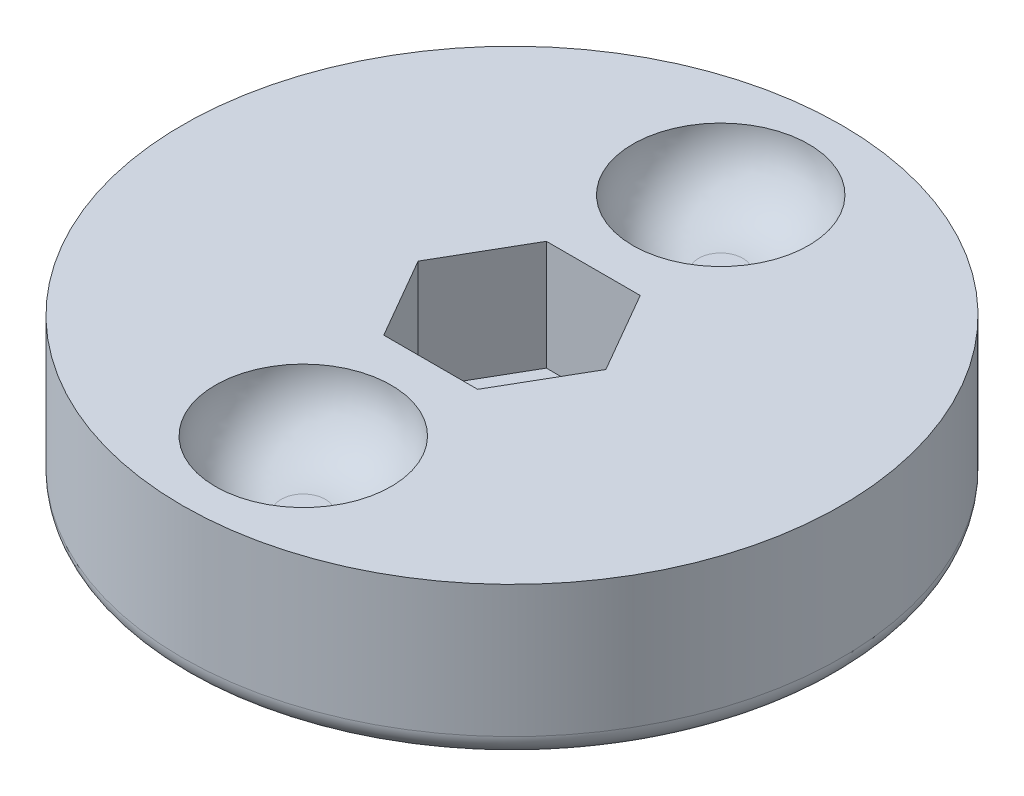
from build123d import *

# Parameters (mm, degrees)
SKETCH1_R           = 19.05
SKETCH1_R_2         = 2.794
BOSS_EXTRUDE1_DEPTH = 2.54
SKETCH2_R           = 19.05
BOSS_EXTRUDE2_DEPTH = 6.35
SKETCH3_R           = 5.08
CUT_EXTRUDE1_DEPTH  = 3.81
FILLET1_R           = 3.81
FILLET2_R           = 1.27


with BuildPart() as part:
    # Sketch1 → Boss-Extrude1 (new body)
    with BuildSketch(Plane(origin=(0, 0, 0), x_dir=(1, 0, 0), z_dir=(0, 1, 0))):
        with Locations(Location((0, 0, 0), (0, 0, 270))):
            Circle(SKETCH1_R)
        with Locations(Location((0, 0, 0), (0, 0, 270))):
            Circle(SKETCH1_R_2, mode=Mode.SUBTRACT)
    extrude(amount=BOSS_EXTRUDE1_DEPTH)

    # Sketch2 → Boss-Extrude2 (add)
    with BuildSketch(Plane(origin=(0, 2.54, 0), x_dir=(1, 0, 0), z_dir=(0, 1, 0))):
        with Locations(Location((0, 0, 0), (0, 0, 270))):
            Circle(SKETCH2_R)
        Polygon((5.42593783, 0), (2.712968915, 4.699), (-2.712968915, 4.699), (-5.42593783, 0), (-2.712968915, -4.699), (2.712968915, -4.699), align=None, mode=Mode.SUBTRACT)
    extrude(amount=BOSS_EXTRUDE2_DEPTH)

    # Sketch3 → Cut-Extrude1 (cut)
    with BuildSketch(Plane(origin=(0, 8.89, 0), x_dir=(1, 0, 0), z_dir=(0, 1, 0))):
        with Locations(Location((0, 12.065, 0), (0, 0, 270))):
            Circle(SKETCH3_R)
        with Locations(Location((0, -12.065, 0), (0, 0, 270))):
            Circle(SKETCH3_R)
    extrude(amount=-CUT_EXTRUDE1_DEPTH, mode=Mode.SUBTRACT)

    # Fillet1
    fillet1_edges = [part.edges().sort_by_distance(p)[0] for p in [
        (0, 5.08, -17.145),
        (0, 5.08, 6.985),
    ]]
    fillet(fillet1_edges, radius=FILLET1_R - 0.0001)  # a hair under: the kernel refuses the full size

    # Fillet2
    fillet2_edges = [part.edges().sort_by_distance(p)[0] for p in [
        (0, 0, -19.05),
    ]]
    fillet(fillet2_edges, radius=FILLET2_R)


solid = part.part
